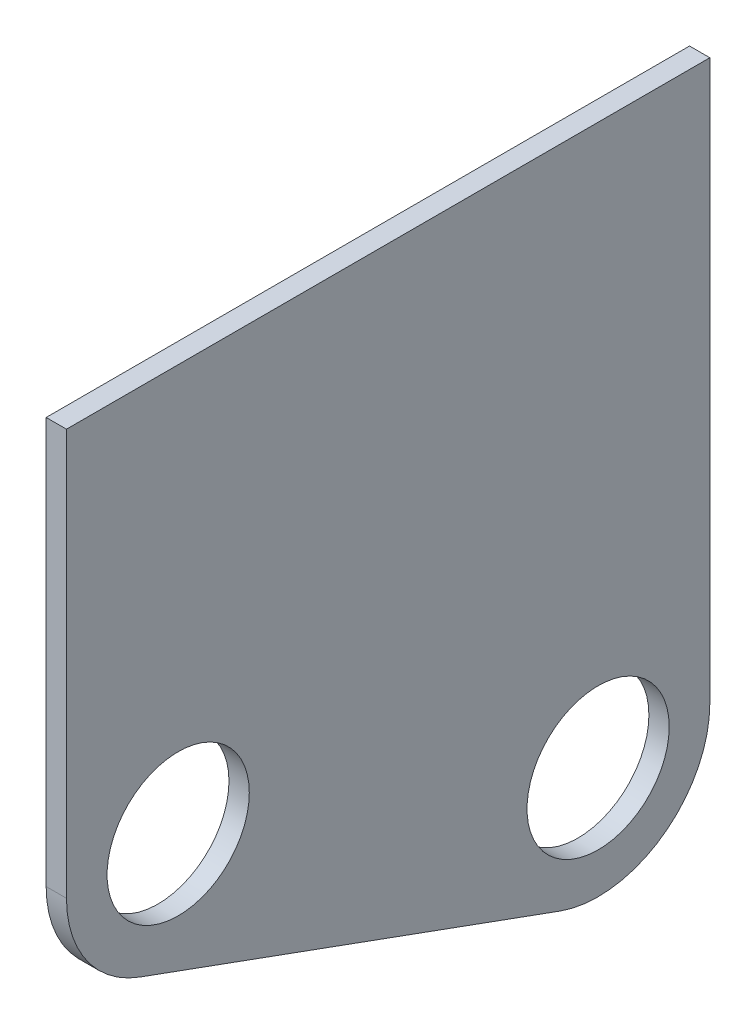
from build123d import *

# Parameters (mm, degrees)
SKETCH2_R           = 11.1125
BOSS_EXTRUDE1_DEPTH = 3.175


with BuildPart() as part:
    # Sketch2 → Boss-Extrude1 (new body)
    with BuildSketch(Plane(origin=(0, 0, 0), x_dir=(0, 0, -1), z_dir=(1, 0, 0))):
        with BuildLine():
            Line((50.281264781, 0), (-50.281264781, 0))
            Line((-50.281264781, 0), (-50.281264781, -63.5))
            ThreePointArc((-50.281264781, -63.5), (-47.123207354, -73.51607852), (-38.791291534, -79.90938239))
            Line((-38.791291534, -79.90938239), (26.846238028, -103.799489402))
            ThreePointArc((26.846238028, -103.799489402), (42.834843301, -101.694549585), (50.281264781, -87.390107011))
            Line((50.281264781, -87.390107011), (50.281264781, 0))
        make_face()
        with Locations((-32.818764781, -63.5)):
            Circle(SKETCH2_R, mode=Mode.SUBTRACT)
        with Locations((32.818764781, -87.390107011)):
            Circle(SKETCH2_R, mode=Mode.SUBTRACT)
    extrude(amount=BOSS_EXTRUDE1_DEPTH)


solid = part.part
